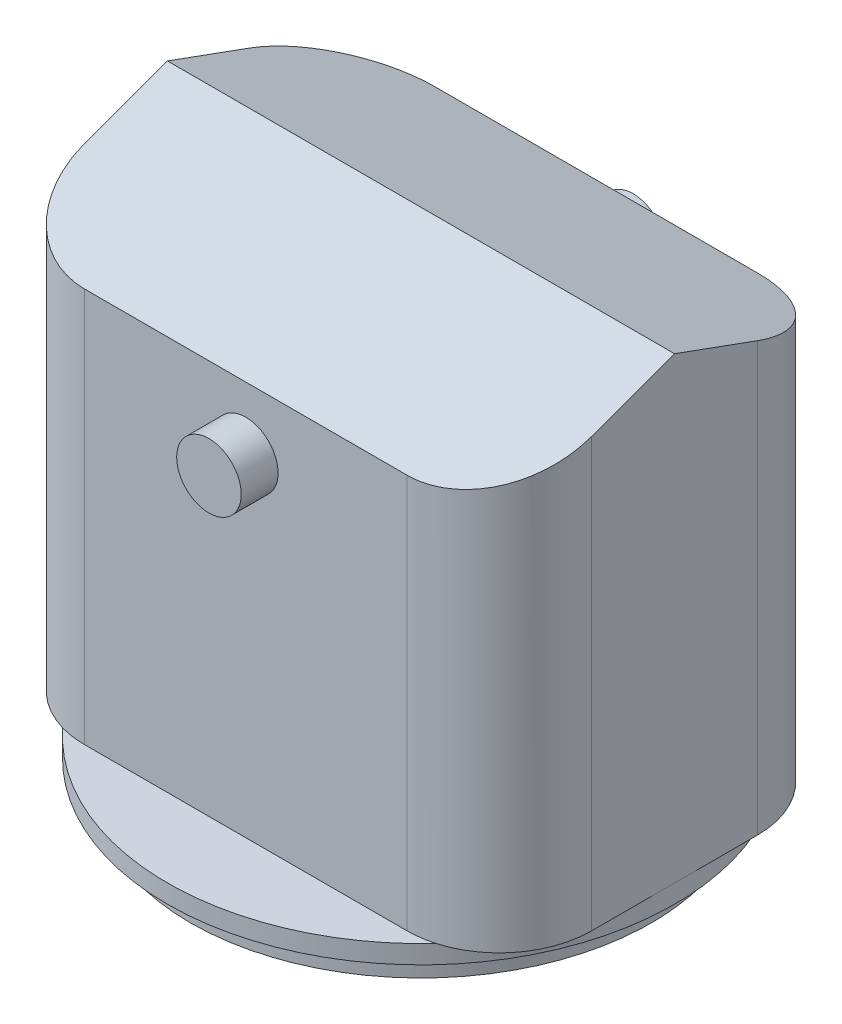
from build123d import *

# Parameters (mm, degrees)
IZIM1_R                     = 27.5
Y_KSEKLIK_EKSTR_ZYON1_DEPTH = 2
IZIM2_R                     = 25
IZIM2_R_2                   = 23
Y_KSEKLIK_EKSTR_ZYON2_DEPTH = 3
Y_KSEKLIK_EKSTR_ZYON3_DEPTH = 50.8
PAH1_SIZE                   = 8
PAH1_SIZE_2                 = 21.979819356
PAH2_SIZE                   = 8
PAH2_SIZE_2                 = 21.979819356
IZIM4_R                     = 3.5
Y_KSEKLIK_EKSTR_ZYON4_DEPTH = 4
Y_KSEKLIK_EKSTR_ZYON5_START = 4
IZIM5_R                     = 3.5
Y_KSEKLIK_EKSTR_ZYON5_DEPTH = 4


with BuildPart() as part:
    # Çizim1 → Yükseklik-Ekstrüzyon1 (new body)
    with BuildSketch(Plane(origin=(0, 0, 0), x_dir=(1, 0, 0), z_dir=(0, 1, 0))):
        with Locations(Location((0, 0, 0), (0, 0, 270))):
            Circle(IZIM1_R)
    extrude(amount=Y_KSEKLIK_EKSTR_ZYON1_DEPTH)

    # Çizim2 → Yükseklik-Ekstrüzyon2 (add)
    with BuildSketch(Plane.XZ):
        with Locations(Location((0, 0, 0), (0, 0, 90))):
            Circle(IZIM2_R)
        with Locations(Location((0, 0, 0), (0, 0, 270))):
            Circle(IZIM2_R_2, mode=Mode.SUBTRACT)
    extrude(amount=Y_KSEKLIK_EKSTR_ZYON2_DEPTH)

    # Çizim3 → Yükseklik-Ekstrüzyon3 (add)
    with BuildSketch(Plane(origin=(0, 2, 0), x_dir=(1, 0, 0), z_dir=(0, 1, 0))):
        with BuildLine():
            Line((-17.5, -19), (17.5, -19))
            ThreePointArc((17.5, -19), (24.571067812, -16.071067812), (27.5, -9))
            Line((27.5, -9), (27.5, 9))
            ThreePointArc((27.5, 9), (24.571067812, 16.071067812), (17.5, 19))
            Line((17.5, 19), (-17.5, 19))
            ThreePointArc((-17.5, 19), (-24.571067812, 16.071067812), (-27.5, 9))
            Line((-27.5, 9), (-27.5, -9))
            ThreePointArc((-27.5, -9), (-24.571067812, -16.071067812), (-17.5, -19))
        make_face()
    extrude(amount=Y_KSEKLIK_EKSTR_ZYON3_DEPTH)

    # Pah1
    # the kernel refuses this chamfer: 21.979819356, 8 mm, written as the material it takes off along each edge
    with BuildSketch(Plane(origin=(74.519931595, 52.8, -19), x_dir=(0, -0.9950833631817486, -0.0990409022520504), z_dir=(-1, 0, 0))) as pah1_piece_1:
        Polygon((PAH1_SIZE * 0.995083363182, PAH1_SIZE * 0.0990409022521), (-PAH1_SIZE_2 * 0.0990409022504, PAH1_SIZE_2 * 0.995083363165), (0, 0), align=None)
    extrude(amount=149.03986319, mode=Mode.SUBTRACT)

    # Pah2
    # the kernel refuses this chamfer: 21.979819356, 8 mm, written as the material it takes off along each edge
    with BuildSketch(Plane(origin=(-74.519931595, 52.8, 19), x_dir=(0, -0.9950833631817486, 0.0990409022520504), z_dir=(1, 0, 0))) as pah2_piece_1:
        Polygon((PAH2_SIZE * 0.995083363182, PAH2_SIZE * 0.0990409022521), (-PAH2_SIZE_2 * 0.0990409022504, PAH2_SIZE_2 * 0.995083363165), (0, 0), align=None)
    extrude(amount=149.03986319, mode=Mode.SUBTRACT)

    # Çizim4 → Yükseklik-Ekstrüzyon4 (add)
    with BuildSketch(Plane.XY.offset(19)):
        with Locations(Location((0, 38, 0), (0, 0, 180))):
            Circle(IZIM4_R)
    extrude(amount=Y_KSEKLIK_EKSTR_ZYON4_DEPTH)

    # Çizim5 → Yükseklik-Ekstrüzyon5 (add)
    with BuildSketch(Plane(origin=(0, 0, -19), x_dir=(-1, 0, 0), z_dir=(0, 0, -1)).offset(Y_KSEKLIK_EKSTR_ZYON5_START)):
        with Locations((0, 38)):
            Circle(IZIM5_R)
    extrude(amount=-Y_KSEKLIK_EKSTR_ZYON5_DEPTH)


solid = part.part
